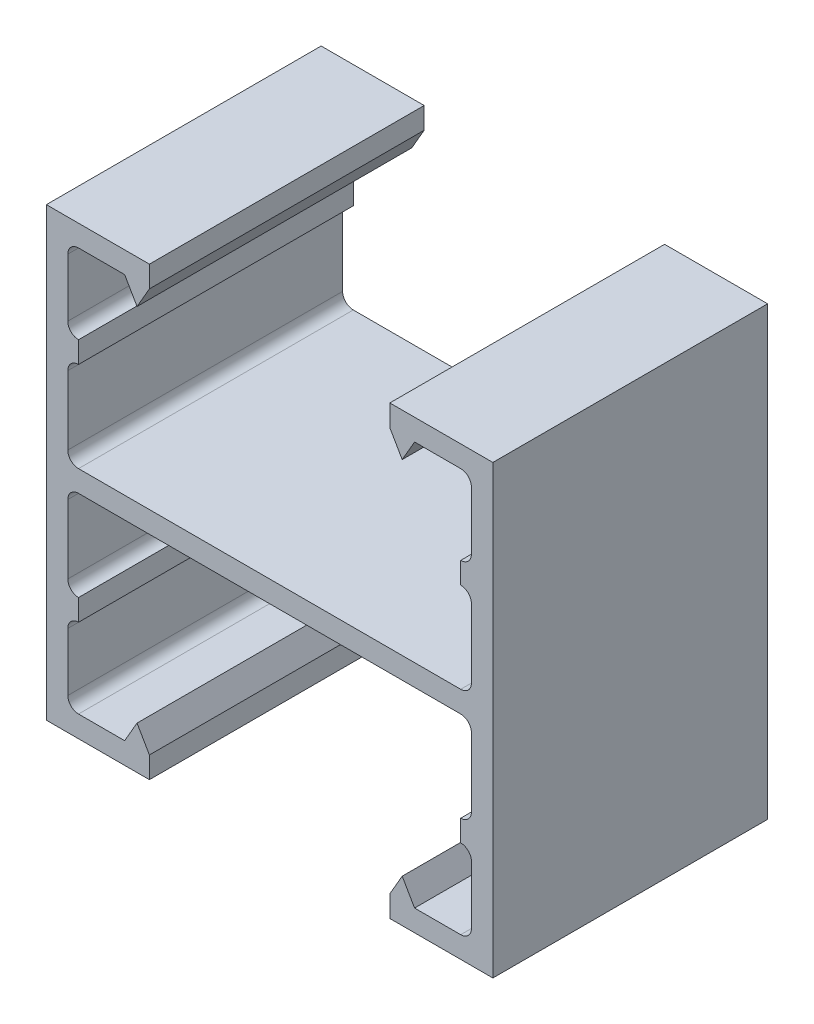
from build123d import *

# Parameters (mm, degrees)
BASE_EXTRUDE_DEPTH = 12.7
FILLET1_R          = 0.9906


with BuildPart() as part:
    # Sketch1 → Base-Extrude (new, symmetric)
    with BuildSketch(Plane.XY):
        with BuildLine():
            Line((-11.1125, 20.6375), (-20.6375, 20.6375))
            Line((-20.6375, 20.6375), (-20.6375, -20.6375))
            Line((-20.6375, -20.6375), (-11.1125, -20.6375))
            Line((-11.1125, -20.6375), (-11.1125, -18.6563))
            Line((-11.1125, -18.6563), (-12.256346355, -16.6751))
            Line((-12.256346355, -16.6751), (-13.400192707, -18.6563))
            Line((-13.400192707, -18.6563), (-17.6657, -18.6563))
            ThreePointArc((-17.6657, -18.6563), (-18.366159977, -18.366159977), (-18.6563, -17.6657))
            Line((-18.6563, -17.6657), (-18.6563, -11.30935))
            Line((-18.6563, -11.30935), (-17.6657, -11.30935))
            Line((-17.6657, -11.30935), (-17.6657, -9.32815))
            Line((-17.6657, -9.32815), (-18.6563, -9.32815))
            Line((-18.6563, -9.32815), (-18.6563, -1.9812))
            ThreePointArc((-18.6563, -1.9812), (-18.366159977, -1.280740023), (-17.6657, -0.9906))
            Line((-17.6657, -0.9906), (17.6657, -0.9906))
            ThreePointArc((17.6657, -0.9906), (18.366159977, -1.280740023), (18.6563, -1.9812))
            Line((18.6563, -1.9812), (18.6563, -9.32815))
            Line((18.6563, -9.32815), (17.6657, -9.32815))
            Line((17.6657, -9.32815), (17.6657, -11.30935))
            Line((17.6657, -11.30935), (18.6563, -11.30935))
            Line((18.6563, -11.30935), (18.6563, -17.6657))
            ThreePointArc((18.6563, -17.6657), (18.366159977, -18.366159977), (17.6657, -18.6563))
            Line((17.6657, -18.6563), (13.400192707, -18.6563))
            Line((13.400192707, -18.6563), (12.256346355, -16.6751))
            Line((12.256346355, -16.6751), (11.1125, -18.6563))
            Line((11.1125, -18.6563), (11.1125, -20.6375))
            Line((11.1125, -20.6375), (20.6375, -20.6375))
            Line((20.6375, -20.6375), (20.6375, 20.6375))
            Line((20.6375, 20.6375), (11.1125, 20.6375))
            Line((11.1125, 20.6375), (11.1125, 18.6563))
            Line((11.1125, 18.6563), (12.256346355, 16.6751))
            Line((12.256346355, 16.6751), (13.400192707, 18.6563))
            Line((13.400192707, 18.6563), (17.6657, 18.6563))
            ThreePointArc((17.6657, 18.6563), (18.366159977, 18.366159977), (18.6563, 17.6657))
            Line((18.6563, 17.6657), (18.6563, 11.30935))
            Line((18.6563, 11.30935), (17.6657, 11.30935))
            Line((17.6657, 11.30935), (17.6657, 9.32815))
            Line((17.6657, 9.32815), (18.6563, 9.32815))
            Line((18.6563, 9.32815), (18.6563, 1.9812))
            ThreePointArc((18.6563, 1.9812), (18.366159977, 1.280740023), (17.6657, 0.9906))
            Line((17.6657, 0.9906), (-17.6657, 0.9906))
            ThreePointArc((-17.6657, 0.9906), (-18.366159977, 1.280740023), (-18.6563, 1.9812))
            Line((-18.6563, 1.9812), (-18.6563, 9.32815))
            Line((-18.6563, 9.32815), (-17.6657, 9.32815))
            Line((-17.6657, 9.32815), (-17.6657, 11.30935))
            Line((-17.6657, 11.30935), (-18.6563, 11.30935))
            Line((-18.6563, 11.30935), (-18.6563, 17.6657))
            ThreePointArc((-18.6563, 17.6657), (-18.366159977, 18.366159977), (-17.6657, 18.6563))
            Line((-17.6657, 18.6563), (-13.400192707, 18.6563))
            Line((-13.400192707, 18.6563), (-12.256346355, 16.6751))
            Line((-12.256346355, 16.6751), (-11.1125, 18.6563))
            Line((-11.1125, 18.6563), (-11.1125, 20.6375))
        make_face()
    extrude(amount=BASE_EXTRUDE_DEPTH, both=True)

    # Fillet1
    fillet1_edges = [part.edges().sort_by_distance(p)[0] for p in [
        (18.6563, 11.30935, 0),
        (18.6563, -9.32815, 0),
        (-18.6563, 11.30935, 0),
        (-18.6563, -9.32815, 0),
        (-18.6563, 9.32815, 0),
        (-18.6563, -11.30935, 0),
        (18.6563, 9.32815, 0),
        (18.6563, -11.30935, 0),
    ]]
    fillet(fillet1_edges, radius=FILLET1_R - 0.0001)  # a hair under: the kernel refuses the full size


solid = part.part
